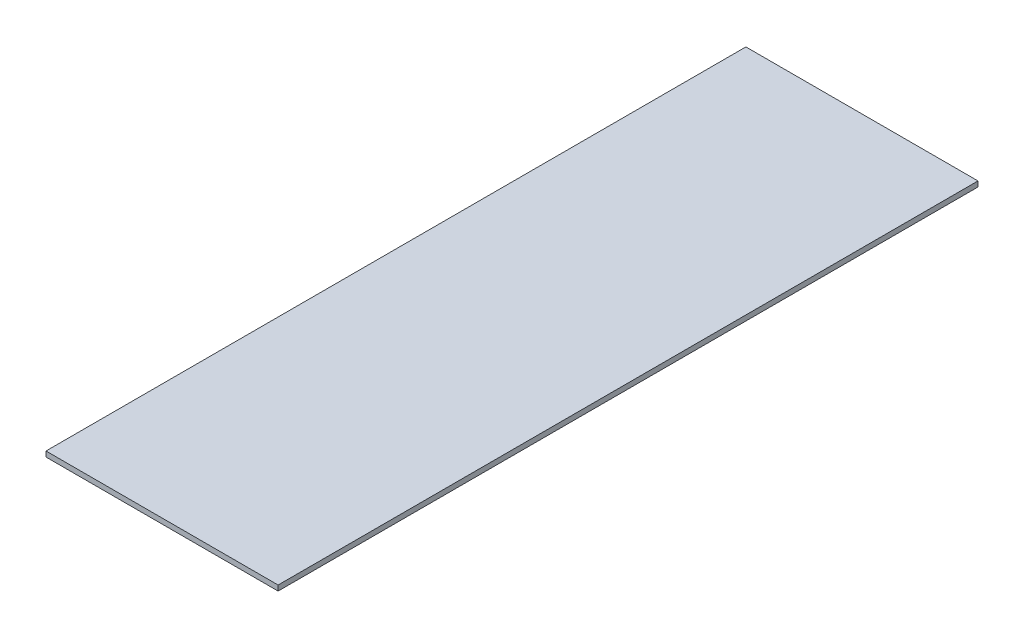
from build123d import *

# Parameters (mm, degrees)
SKETCH1_W           = 1676.4
SKETCH1_H           = 38.1
BOSS_EXTRUDE1_DEPTH = 5054.6


with BuildPart() as part:
    # Sketch1 → Boss-Extrude1 (new body)
    with BuildSketch(Plane.XY):
        with Locations((838.2, 19.05)):
            Rectangle(SKETCH1_W, SKETCH1_H)
    extrude(amount=BOSS_EXTRUDE1_DEPTH)


solid = part.part
